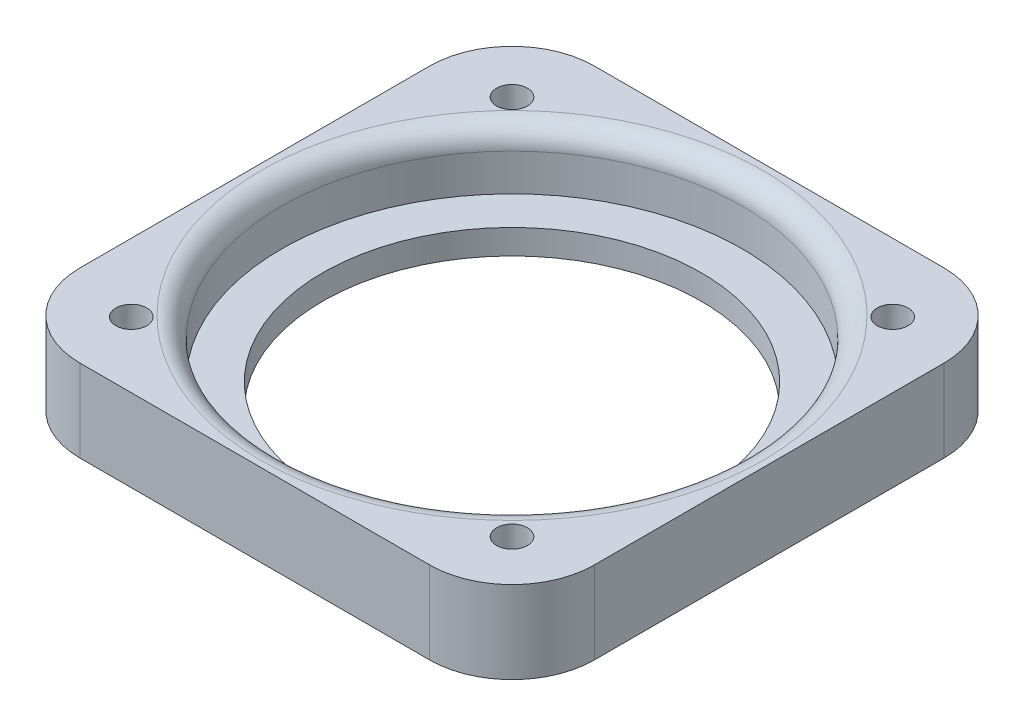
from build123d import *
from build123d.topology import SkipClean

# Parameters (mm, degrees)
SKETCH_1_R               = 25
EXTRUDE_1_DEPTH          = 8
SKETCH_2_R               = 22.4
CUT_EXTRUDE_1_DEPTH      = 5.6
SKETCH_3_R               = 18.4
CUT_EXTRUDE_2_DEPTH      = 12.5
EXTRUDE_2_DEPTH          = 8
FILLET_1_R               = 8
CUT_EXTRUDE_START        = -15
SKETCH_5_R               = 1.5
CUT_EXTRUDE_3_DEPTH      = 15
FILLET_2_R               = 2
SKETCH_6_R               = 3.5
CUT_EXTRUDE_4_DEPTH      = 2
PATTERN_CIRCULAR_1_COUNT = 4


with BuildPart() as part:
    # 草图1 → 凸台-拉伸1 (new body)
    with BuildSketch(Plane(origin=(0, 0, 0), x_dir=(1, 0, 0), z_dir=(0, 1, 0))):
        Circle(SKETCH_1_R)
    extrude(amount=EXTRUDE_1_DEPTH)

    # 草图2 → 切除-拉伸1 (cut)
    with BuildSketch(Plane(origin=(0, 8, 0), x_dir=(1, 0, 0), z_dir=(0, 1, 0))):
        Circle(SKETCH_2_R)
    extrude(amount=-CUT_EXTRUDE_1_DEPTH, mode=Mode.SUBTRACT)

    # 草图3 → 切除-拉伸2 (cut)
    with BuildSketch(Plane(origin=(0, 2.4, 0), x_dir=(1, 0, 0), z_dir=(0, 1, 0))):
        Circle(SKETCH_3_R)
    extrude(amount=-CUT_EXTRUDE_2_DEPTH, mode=Mode.SUBTRACT)

    # 草图4 → 凸台-拉伸2 (add)
    with BuildSketch(Plane(origin=(0, 0, 0), x_dir=(1, 0, 0), z_dir=(0, 1, 0))):
        with BuildLine():
            Line((0, 25), (-25, 25))
            Line((-25, 25), (-25, 2.6e-08))
            ThreePointArc((-25, 2.6e-08), (-23.301207713, 9.058350794), (-18.435702489, 16.885641052))
            ThreePointArc((-18.435702489, 16.885641052), (-19.445436483, 19.445436483), (-16.885641052, 18.435702489))
            ThreePointArc((-16.885641052, 18.435702489), (-9.058350782, 23.301207718), (0, 25))
        make_face()
        with BuildLine():
            Line((25, 25), (0, 25))
            ThreePointArc((0, 25), (9.210354363, 23.241544108), (17.125028574, 18.213549801))
            ThreePointArc((17.125028574, 18.213549801), (19.682469279, 19.438809921), (18.425448396, 16.896829626))
            ThreePointArc((18.425448396, 16.896829626), (23.298457137, 9.065423048), (25, 0))
            Line((25, 0), (25, 25))
        make_face()
        with BuildLine():
            ThreePointArc((-18.213549801, -17.125028574), (-23.241544113, -9.210354351), (-25, 2.6e-08))
            Line((-25, 2.6e-08), (-25, -25))
            Line((-25, -25), (-5.8e-08, -25))
            ThreePointArc((-5.8e-08, -25), (-9.065423076, -23.298457126), (-16.896829626, -18.425448396))
            ThreePointArc((-16.896829626, -18.425448396), (-19.438809921, -19.682469279), (-18.213549801, -17.125028574))
        make_face()
        with BuildLine():
            Line((25, -25), (25, 0))
            ThreePointArc((25, 0), (23.22561674, -9.250444694), (18.154341838, -17.18778265))
            ThreePointArc((18.154341838, -17.18778265), (19.675883861, -19.675883861), (17.18778265, -18.154341838))
            ThreePointArc((17.18778265, -18.154341838), (9.250444666, -23.225616751), (-5.8e-08, -25))
            Line((-5.8e-08, -25), (25, -25))
        make_face()
    extrude(amount=EXTRUDE_2_DEPTH)

    # 圆角1
    fillet_1_edges = [part.edges().sort_by_distance(p)[0] for p in [
        (-25, 4, 25),
        (25, 4, 25),
        (25, 4, -25),
        (-25, 4, -25),
    ]]
    fillet(fillet_1_edges, radius=FILLET_1_R)

    # 草图5 → 切除-拉伸3 (cut)
    with SkipClean():  # the faces are left unmerged after this step: merging them gives an invalid solid
        with BuildSketch(Plane(origin=(0, 8, 0), x_dir=(1, 0, 0), z_dir=(0, 1, 0)).offset(CUT_EXTRUDE_START)):
            with Locations((-18.384776311, 18.384776311)):
                Circle(SKETCH_5_R)
            with Locations((18.615223689, 18.384776311)):
                Circle(SKETCH_5_R)
            with Locations((18.615223689, -18.615223689)):
                Circle(SKETCH_5_R)
            with Locations((-18.384776311, -18.615223689)):
                Circle(SKETCH_5_R)
        extrude(amount=CUT_EXTRUDE_3_DEPTH, mode=Mode.SUBTRACT)

    # 圆角2
    fillet_2_edges = [part.edges().sort_by_distance(p)[0] for p in [
        (-22.4, 8, 0),
    ]]
    fillet(fillet_2_edges, radius=FILLET_2_R)

    # 草图6 → 切除-拉伸4 (cut)
    with SkipClean():  # the faces are left unmerged after this step: merging them gives an invalid solid
        with BuildSketch(Plane.XZ):
            with Locations((-18.384776311, 18.615223689)):
                Circle(SKETCH_6_R)
        cut_extrude_4 = extrude(amount=-CUT_EXTRUDE_4_DEPTH, mode=Mode.SUBTRACT)

    # 阵列(圆周)1: 切除-拉伸4 ×4 about axis
    with SkipClean():  # the faces are left unmerged after this step: merging them gives an invalid solid
        pattern_circular_1_axis = Axis((0, 0, 0), (0, 1, 0))
        for i in range(1, PATTERN_CIRCULAR_1_COUNT):
            add(cut_extrude_4.rotate(pattern_circular_1_axis, i * 360 / PATTERN_CIRCULAR_1_COUNT), mode=Mode.SUBTRACT)


solid = part.part
